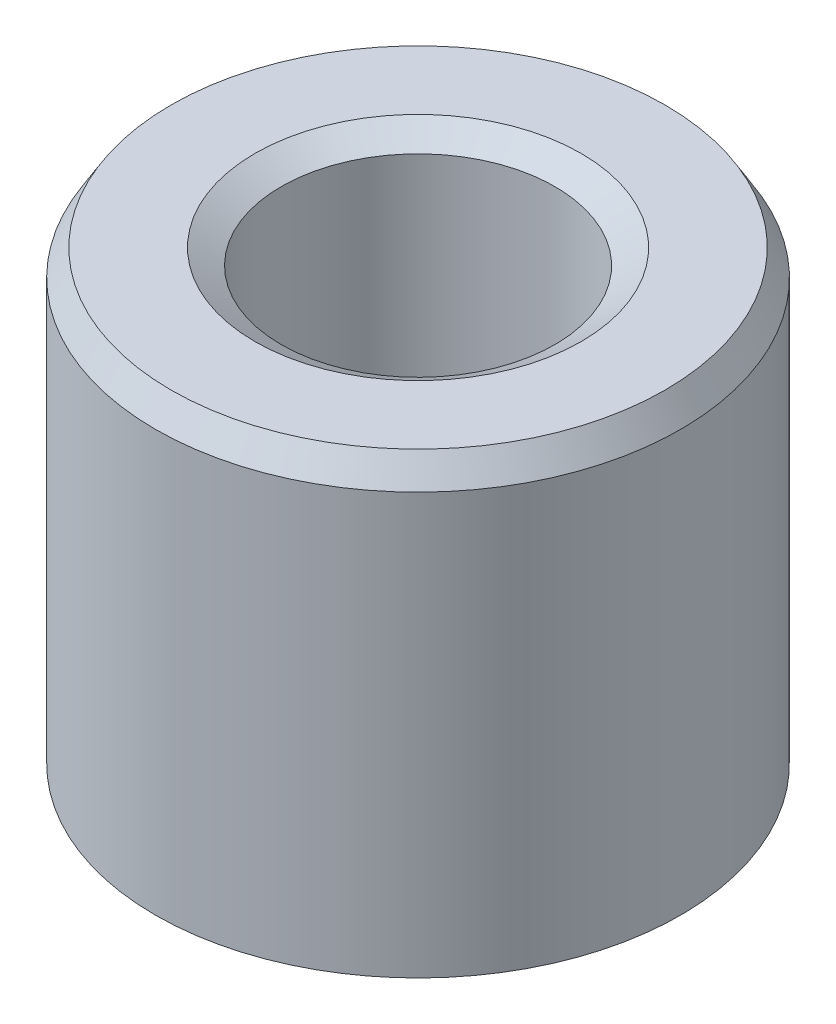
from build123d import *
from OCP.BRepFilletAPI import BRepFilletAPI_MakeChamfer

# Parameters (mm, degrees)
SKETCH1_R           = 10
BOSS_EXTRUDE1_DEPTH = 17.613700112
SKETCH2_R           = 5.211533641
CUT_EXTRUDE1_DEPTH  = 23.58854647
CHAMFER1_SIZE       = 0.997216956
CHAMFER1_SIZE2      = 0.59595946


with BuildPart() as part:
    # Sketch1 → Boss-Extrude1 (new body)
    with BuildSketch(Plane(origin=(0, 0, 0), x_dir=(1, 0, 0), z_dir=(0, 1, 0))):
        Circle(SKETCH1_R)
    extrude(amount=BOSS_EXTRUDE1_DEPTH)

    # Sketch2 → Cut-Extrude1 (cut, through all)
    with BuildSketch(Plane(origin=(0, 0, 0), x_dir=(1, 0, 0), z_dir=(0, 1, 0))):
        Circle(SKETCH2_R)
    extrude(amount=CUT_EXTRUDE1_DEPTH, mode=Mode.SUBTRACT)

    # Chamfer1: one chamfer whose edges measure the first distance from different faces: ONE call of the kernel's chamfer builder (chamfer() names one face for all edges)
    chamfer1_edges_1 = [part.edges().sort_by_distance(p)[0] for p in [
        (-5.211533641, 17.613700112, 0),
    ]]
    chamfer1_side_1 = [part.faces().sort_by_distance(p)[0] for p in [
        (-9.717157288, 17.613700112, 0),
    ]]
    chamfer1_edges_2 = [part.edges().sort_by_distance(p)[0] for p in [
        (-5.211533641, 0, 0),
    ]]
    chamfer1_side_2 = [part.faces().sort_by_distance(p)[0] for p in [
        (-5.211533641, 8.806850056, 0),
    ]]
    chamfer1_edges_3 = [part.edges().sort_by_distance(p)[0] for p in [
        (-10, 0, 0),
    ]]
    chamfer1_side_3 = [part.faces().sort_by_distance(p)[0] for p in [
        (-9.717157288, 0, 0),
    ]]
    chamfer1_edges_4 = [part.edges().sort_by_distance(p)[0] for p in [
        (-10, 17.613700112, 0),
    ]]
    chamfer1_side_4 = [part.faces().sort_by_distance(p)[0] for p in [
        (-10, 8.806850056, 0),
    ]]
    chamfer1 = BRepFilletAPI_MakeChamfer(part.part.solid().wrapped)
    for e in chamfer1_edges_1:
        chamfer1.Add(CHAMFER1_SIZE, CHAMFER1_SIZE2, e.wrapped, chamfer1_side_1[0].wrapped)  # the first distance lies on this face
    for e in chamfer1_edges_2:
        chamfer1.Add(CHAMFER1_SIZE, CHAMFER1_SIZE2, e.wrapped, chamfer1_side_2[0].wrapped)  # the first distance lies on this face
    for e in chamfer1_edges_3:
        chamfer1.Add(CHAMFER1_SIZE, CHAMFER1_SIZE2, e.wrapped, chamfer1_side_3[0].wrapped)  # the first distance lies on this face
    for e in chamfer1_edges_4:
        chamfer1.Add(CHAMFER1_SIZE, CHAMFER1_SIZE2, e.wrapped, chamfer1_side_4[0].wrapped)  # the first distance lies on this face
    add(Compound.cast(chamfer1.Shape()), mode=Mode.REPLACE)


solid = part.part
